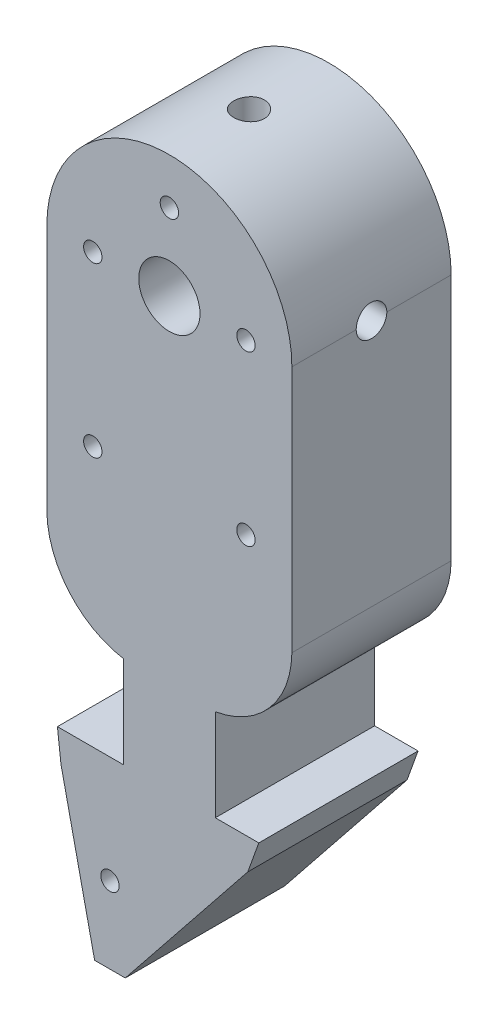
from build123d import *

# Parameters (mm, degrees)
EXTRUDE_1_DEPTH          = 26
SKETCH_2_R               = 5
CUT_EXTRUDE_1_DEPTH      = 26
SKETCH_5_R               = 2.5
CUT_EXTRUDE_3_DEPTH      = 12
CUT_EXTRUDE_START        = -12
SKETCH_6_R               = 2.5
CUT_EXTRUDE_4_DEPTH      = 12
CUT_EXTRUDE_5_REACH      = 109.051
SKETCH_7_R               = 1.5
CUT_EXTRUDE_6_REACH      = 107.243
CUT_EXTRUDE_6_END_RADIUS = 20
SKETCH_8_R               = 1.5
SKETCH_10_R              = 2.5
CUT_EXTRUDE_7_DEPTH      = 12
CUT_EXTRUDE_8_REACH      = 107.243
CUT_EXTRUDE_START_2      = -26
CUT_EXTRUDE_9_DEPTH      = 26
SKETCH_13_R              = 1.5
CUT_EXTRUDE_10_DEPTH     = 5
CUT_EXTRUDE_START_3      = -5
SKETCH_14_R              = 1.5
CUT_EXTRUDE_11_DEPTH     = 5


# Read off the part's stored shape, not the designer's step: 切除-拉伸9
with BuildPart() as part:
    # 草图1 → 凸台-拉伸1 (new body)
    with BuildSketch(Plane.XY):
        with BuildLine():
            ThreePointArc((20, 0), (0, 20), (-20, 0))
            Line((-20, 0), (20, 0))
        make_face()
        with BuildLine():
            Line((20, 0), (-20, 0))
            ThreePointArc((-20, 0), (0, -20), (20, 0))
        make_face()
        with BuildLine():
            ThreePointArc((20, 0), (0, -20), (-20, 0))
            Line((-20, 0), (-20, -55))
            Line((-20, -55), (20, -55))
            Line((20, -55), (20, 0))
        make_face()
        Polygon((20, -55), (-20, -55), (-17.7, -75), (-12.2, -100), (-7.2, -100), (12.8, -75), align=None)
    extrude(amount=EXTRUDE_1_DEPTH)

    # 草图2 → 切除-拉伸1 (cut)
    with BuildSketch(Plane.XY.offset(26)):
        Circle(SKETCH_2_R)
    extrude(amount=-CUT_EXTRUDE_1_DEPTH, mode=Mode.SUBTRACT)

    # 草图5 → 切除-拉伸3 (cut)
    with BuildSketch(Plane.ZY.offset(20)):
        with Locations(Location((13, 0, 0), (0, 0, 270))):
            Circle(SKETCH_5_R)
    extrude(amount=-CUT_EXTRUDE_3_DEPTH, mode=Mode.SUBTRACT)

    # 草图6 → 切除-拉伸4 (cut)
    with BuildSketch(Plane(origin=(20, 0, 0), x_dir=(0, 0, -1), z_dir=(1, 0, 0)).offset(CUT_EXTRUDE_START)):
        with Locations(Location((-13, 0, 0), (0, 0, 270))):
            Circle(SKETCH_6_R)
    extrude(amount=CUT_EXTRUDE_4_DEPTH, mode=Mode.SUBTRACT)

    # 切除-拉伸5: up to this face of the body (flat: up to its plane)
    cut_extrude_5_end = Plane(part.part.faces().sort_by_distance((-8, 0, 13))[0])
    # 草图7 → 切除-拉伸5 (cut, up to the picked face)
    with BuildSketch(Plane(origin=(8, 0, 0), x_dir=(0, 0, -1), z_dir=(1, 0, 0)), mode=Mode.PRIVATE) as cut_extrude_5_sk1:
        with Locations(Location((-13, 0, 0), (0, 0, 90))):
            Circle(SKETCH_7_R)
    cut_extrude_5_tool1 = split(extrude(cut_extrude_5_sk1.sketch, amount=-CUT_EXTRUDE_5_REACH, mode=Mode.PRIVATE), bisect_by=cut_extrude_5_end, keep=Keep.BOTH, mode=Mode.PRIVATE)
    add(cut_extrude_5_tool1.solids().sort_by(Axis((8, 0, 13), (-1, 0, 0)))[0], mode=Mode.SUBTRACT)

    # 切除-拉伸6: up to this cylinder (the profile starts inside it)
    cut_extrude_6_end = Plane(origin=(0, 0, 13), z_dir=(0, 0, -1)) * Cylinder(CUT_EXTRUDE_6_END_RADIUS, 255.486, mode=Mode.PRIVATE)
    # 草图8 → 切除-拉伸6 (cut, up to the surface)
    with BuildSketch(Plane(origin=(0, 0, 0), x_dir=(1, 0, 0), z_dir=(0, 1, 0)), mode=Mode.PRIVATE) as cut_extrude_6_sk1:
        with Locations(Location((0, -13, 0), (0, 0, 90))):
            Circle(SKETCH_8_R)
    cut_extrude_6_tool1 = extrude(cut_extrude_6_sk1.sketch, amount=CUT_EXTRUDE_6_REACH, mode=Mode.PRIVATE) & cut_extrude_6_end
    add(cut_extrude_6_tool1.solids().sort_by_distance((0, 0, 13))[0], mode=Mode.SUBTRACT)

    # 草图10 → 切除-拉伸7 (cut)
    with BuildSketch(Plane(origin=(0, 20, 0), x_dir=(1, 0, 0), z_dir=(0, 1, 0))):
        with Locations(Location((0, -13, 0), (0, 0, 270))):
            Circle(SKETCH_10_R)
    extrude(amount=-CUT_EXTRUDE_7_DEPTH, mode=Mode.SUBTRACT)

    # 草图11 → 切除-拉伸8 (cut, up to next)
    with BuildSketch(Plane.XY.offset(26), mode=Mode.PRIVATE) as cut_extrude_8_sk1:
        Polygon((-7.5, -55), (-20, -55), (-18.275, -70), (-7.5, -70), align=None)
    cut_extrude_8_tool1 = extrude(cut_extrude_8_sk1.sketch, amount=-CUT_EXTRUDE_8_REACH, mode=Mode.PRIVATE) & part.part
    # 草图11 → 切除-拉伸8 (cut, up to next)
    with BuildSketch(Plane.XY.offset(26), mode=Mode.PRIVATE) as cut_extrude_8_sk2:
        Polygon((20, -55), (7.5, -55), (7.5, -70), (14.6, -70), align=None)
    cut_extrude_8_tool2 = extrude(cut_extrude_8_sk2.sketch, amount=-CUT_EXTRUDE_8_REACH, mode=Mode.PRIVATE) & part.part
    add(cut_extrude_8_tool1.solids().sort_by_distance((-13.329404, -62.314715, 26))[0], mode=Mode.SUBTRACT)
    add(cut_extrude_8_tool2.solids().sort_by_distance((12.52398, -61.811224, 26))[0], mode=Mode.SUBTRACT)

    # 切除-拉伸9 outline → 切除-拉伸9 (cut)
    with BuildSketch(Plane.XY.offset(26).offset(CUT_EXTRUDE_START_2)):
        with BuildLine():
            ThreePointArc((-7.5, -55), (-16.389505797, -49.97236528), (-20, -40.419106371))
            Line((-20, -40.419106371), (-20, -55))
            Line((-20, -55), (-7.5, -55))
        make_face()
        with BuildLine():
            ThreePointArc((20, -40.419106371), (16.389505797, -49.97236528), (7.5, -55))
            Line((7.5, -55), (20, -55))
            Line((20, -55), (20, -40.419106371))
        make_face()
    extrude(amount=CUT_EXTRUDE_9_DEPTH, mode=Mode.SUBTRACT)

    # 草图13 → 切除-拉伸10 (cut)
    with BuildSketch(Plane.XY.offset(26)):
        with Locations((-12.5, -27.5)):
            Circle(SKETCH_13_R)
        with Locations((12.5, -27.5)):
            Circle(SKETCH_13_R)
        with Locations((12.5, 0)):
            Circle(SKETCH_13_R)
        with Locations((0, 12.5)):
            Circle(SKETCH_13_R)
        with Locations((-12.5, 0)):
            Circle(SKETCH_13_R)
        with Locations((-9.7, -87.5)):
            Circle(SKETCH_13_R)
    extrude(amount=-CUT_EXTRUDE_10_DEPTH, mode=Mode.SUBTRACT)

    # 草图14 → 切除-拉伸11 (cut)
    with BuildSketch(Plane(origin=(0, 0, 0), x_dir=(-1, 0, 0), z_dir=(0, 0, -1)).offset(CUT_EXTRUDE_START_3)):
        with Locations(Location((12.5, 0, 0), (0, 0, 180))):
            Circle(SKETCH_14_R)
        with Locations(Location((0, 12.5, 0), (0, 0, 180))):
            Circle(SKETCH_14_R)
        with Locations(Location((-12.5, 0, 0), (0, 0, 180))):
            Circle(SKETCH_14_R)
        with Locations(Location((-12.5, -27.5, 0), (0, 0, 180))):
            Circle(SKETCH_14_R)
        with Locations(Location((12.5, -27.5, 0), (0, 0, 180))):
            Circle(SKETCH_14_R)
        with Locations(Location((9.7, -87.5, 0), (0, 0, 180))):
            Circle(SKETCH_14_R)
    extrude(amount=CUT_EXTRUDE_11_DEPTH, mode=Mode.SUBTRACT)


solid = part.part
